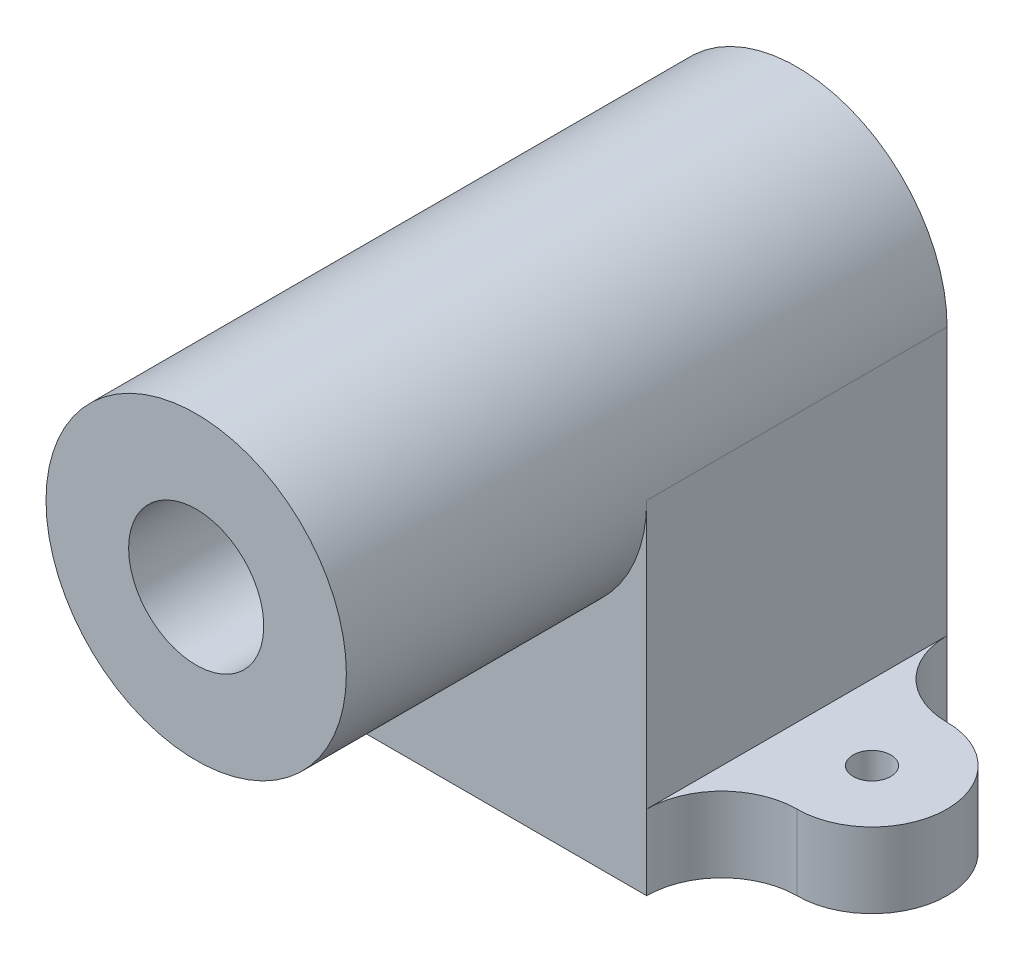
from build123d import *

# Parameters (mm, degrees)
SKETCH1_R           = 1.25
BOSS_EXTRUDE1_DEPTH = 5
SKETCH2_W           = 20
SKETCH2_H           = 20
BOSS_EXTRUDE2_DEPTH = 17.8
SKETCH3_R           = 10
BOSS_EXTRUDE3_DEPTH = 40
CUT_EXTRUDE1_DEPTH  = 56.46025604
FILLET1_R           = 5
CHAMFER2_SIZE       = 3


with BuildPart() as part:
    # Sketch1 → Boss-Extrude1 (new body)
    with BuildSketch(Plane(origin=(0, 0, 0), x_dir=(1, 0, 0), z_dir=(0, 1, 0))):
        with BuildLine():
            Line((-10, -10), (10, -10))
            Line((10, -10), (10, -5))
            Line((10, -5), (15, -5))
            ThreePointArc((15, -5), (20, 0), (15, 5))
            Line((15, 5), (10, 5))
            Line((10, 5), (10, 10))
            Line((10, 10), (-10, 10))
            Line((-10, 10), (-10, 5))
            Line((-10, 5), (-15, 5))
            ThreePointArc((-15, 5), (-20, 0), (-15, -5))
            Line((-15, -5), (-10, -5))
            Line((-10, -5), (-10, -10))
        make_face()
        with Locations(Location((-15, 0, 0), (0, 0, 270))):
            Circle(SKETCH1_R, mode=Mode.SUBTRACT)
        with Locations(Location((15, 0, 0), (0, 0, 90))):
            Circle(SKETCH1_R, mode=Mode.SUBTRACT)
    extrude(amount=BOSS_EXTRUDE1_DEPTH)

    # Sketch2 → Boss-Extrude2 (add)
    with BuildSketch(Plane(origin=(0, 5, 0), x_dir=(1, 0, 0), z_dir=(0, 1, 0))):
        Rectangle(SKETCH2_W, SKETCH2_H)
    extrude(amount=BOSS_EXTRUDE2_DEPTH)

    # Sketch3 → Boss-Extrude3 (add)
    with BuildSketch(Plane(origin=(0, 0, -10), x_dir=(-1, 0, 0), z_dir=(0, 0, -1))):
        with Locations((0, 22.8)):
            Circle(SKETCH3_R)
    extrude(amount=-BOSS_EXTRUDE3_DEPTH)

    # Sketch3<3> → Cut-Extrude1 (cut, through all)
    with BuildSketch(Plane(origin=(0, 0, -10), x_dir=(-1, 0, 0), z_dir=(0, 0, -1))):
        with BuildLine():
            Line((-4.5, 22.8), (4.5, 22.8))
            ThreePointArc((4.5, 22.8), (0, 27.3), (-4.5, 22.8))
        make_face()
        with BuildLine():
            ThreePointArc((-4.5, 22.8), (0, 18.3), (4.5, 22.8))
            Line((4.5, 22.8), (-4.5, 22.8))
        make_face()
    extrude(amount=-CUT_EXTRUDE1_DEPTH, mode=Mode.SUBTRACT)

    # Fillet1
    fillet1_edges = [part.edges().sort_by_distance(p)[0] for p in [
        (10, 2.5, -5),
        (10, 2.5, 5),
        (-10, 2.5, 5),
        (-10, 2.5, -5),
    ]]
    fillet(fillet1_edges, radius=FILLET1_R - 0.0001)  # a hair under: the kernel refuses the full size

    # Chamfer2
    chamfer2_edges = [part.edges().sort_by_distance(p)[0] for p in [
        (4.5, 22.8, -10),
    ]]
    chamfer(chamfer2_edges, length=CHAMFER2_SIZE)


solid = part.part
